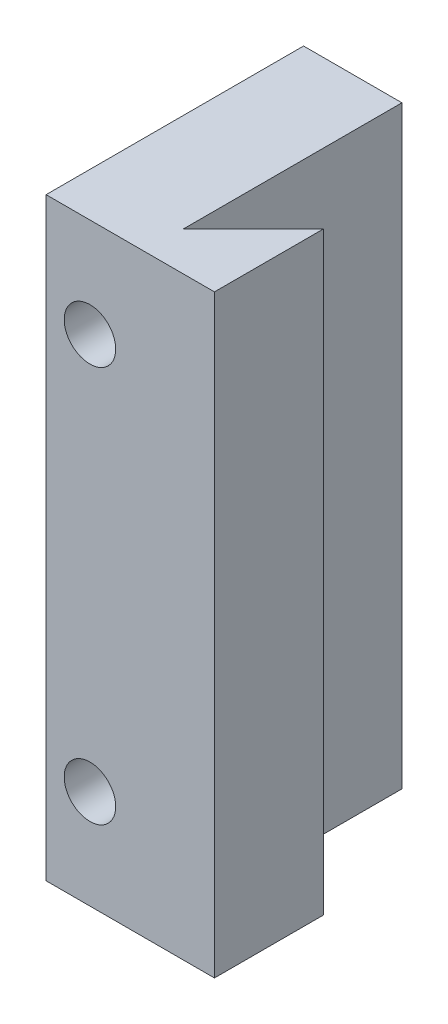
from build123d import *

# Parameters (mm, degrees)
STOCK_NOZZLE4_1_OUTLINE_W = 4.964466094
STOCK_NOZZLE4_1_OUTLINE_H = 15
STOCK_NOZZLE4_1_DEPTH     = 50
STOCK_NOZZLE4_1_START     = 20
STOCK_NOZZLE4_1_2_DEPTH   = 30
SKETCH1_W                 = 20
SKETCH1_H                 = 2
CUT_EXTRUDE1_DEPTH        = 80.180046713
SKETCH2_W                 = 11.16019391
SKETCH2_H                 = 20
CUT_EXTRUDE2_DEPTH        = 79.825629065
SKETCH6_R                 = 1.3
CUT_EXTRUDE3_DEPTH        = 79.825629065
SKETCH7_W                 = 1.8
SKETCH7_H                 = 4.2
CUT_EXTRUDE4_DEPTH        = 4.964466094
SKETCH8_R                 = 3.75
CUT_EXTRUDE5_DEPTH        = 2


# Read off the part's stored shape, not the designer's step: Stock-nozzle4-1
with BuildPart() as part:
    # Stock-nozzle4-1 outline → Stock-nozzle4-1 (new body)
    with BuildSketch(Plane(origin=(0, 0, 0), x_dir=(1, 0, 0), z_dir=(0, 1, 0))):
        with Locations((53.517766953, -7.5)):
            Rectangle(STOCK_NOZZLE4_1_OUTLINE_W, STOCK_NOZZLE4_1_OUTLINE_H)
    extrude(amount=STOCK_NOZZLE4_1_DEPTH)

    # Stock-nozzle4-1 2 outline → Stock-nozzle4-1 2 (add)
    with BuildSketch(Plane(origin=(0, 0, 0), x_dir=(1, 0, 0), z_dir=(0, 1, 0)).offset(STOCK_NOZZLE4_1_START)):
        Polygon((56, -11.035533906), (56, -15), (59.535533906, -15), (59.535533906, -7.5), align=None)
    extrude(amount=STOCK_NOZZLE4_1_2_DEPTH)

    # Sketch1 → Cut-Extrude1 (cut, through all)
    with BuildSketch(Plane(origin=(0, 50, 0), x_dir=(1, 0, 0), z_dir=(0, 1, 0))):
        with Locations((59.035533906, -14)):
            Rectangle(SKETCH1_W, SKETCH1_H)
    extrude(amount=-CUT_EXTRUDE1_DEPTH, mode=Mode.SUBTRACT)

    # Sketch2 → Cut-Extrude2 (cut, through all)
    with BuildSketch(Plane.XY.offset(13)):
        with Locations((56.580096955, 10)):
            Rectangle(SKETCH2_W, SKETCH2_H)
    extrude(amount=-CUT_EXTRUDE2_DEPTH, mode=Mode.SUBTRACT)

    # Sketch6 → Cut-Extrude3 (cut, through all)
    with BuildSketch(Plane.XY.offset(13)):
        with Locations((53.25, 45)):
            Circle(SKETCH6_R)
        with Locations((53.25, 25)):
            Circle(SKETCH6_R)
    extrude(amount=-CUT_EXTRUDE3_DEPTH, mode=Mode.SUBTRACT)

    # Sketch7 → Cut-Extrude4 (cut)
    with BuildSketch(Plane.ZY.offset(-51.035533906)):
        with Locations((5.9, 44.8)):
            Rectangle(SKETCH7_W, SKETCH7_H)
        with Locations((5.9, 24.8)):
            Rectangle(SKETCH7_W, SKETCH7_H)
    extrude(amount=-CUT_EXTRUDE4_DEPTH, mode=Mode.SUBTRACT)

    # Sketch8 → Cut-Extrude5 (cut)
    with BuildSketch(Plane(origin=(0, 0, 0), x_dir=(-1, 0, 0), z_dir=(0, 0, -1))):
        with Locations((-48.435533906, 30.5)):
            Circle(SKETCH8_R)
    extrude(amount=-CUT_EXTRUDE5_DEPTH, mode=Mode.SUBTRACT)


solid = part.part
